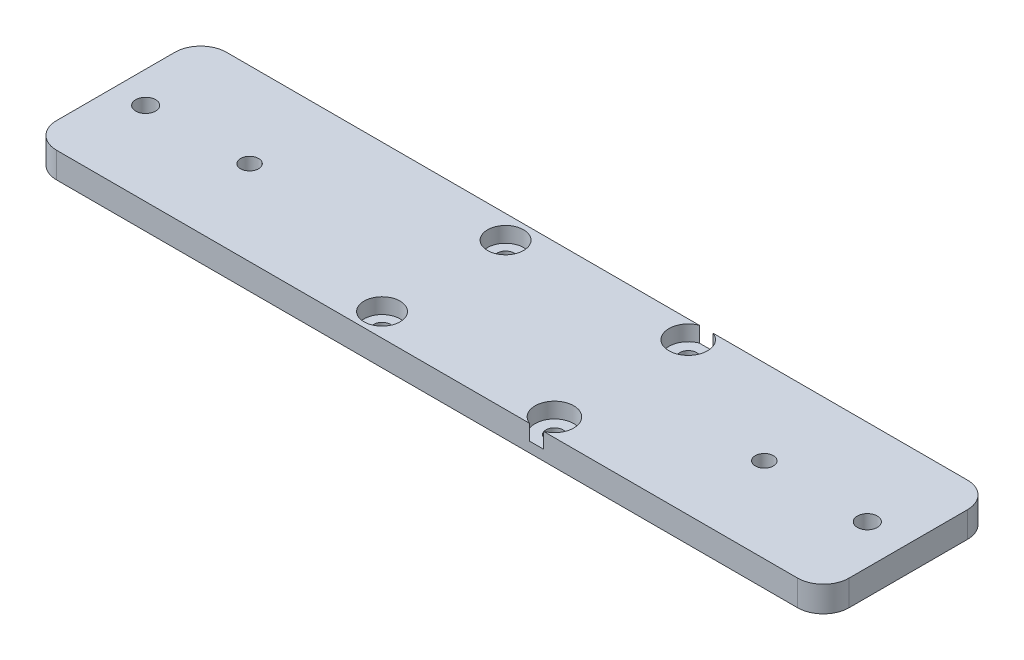
from build123d import *

# Parameters (mm, degrees)
SKETCH1_W           = 42
SKETCH1_H           = 33
BOSS_EXTRUDE1_DEPTH = 5
SKETCH2_W           = 33
SKETCH2_H           = 5
BOSS_EXTRUDE2_DEPTH = 60
SKETCH3_W           = 33
SKETCH3_H           = 5
BOSS_EXTRUDE3_DEPTH = 52
FILLET1_R           = 5
SKETCH6_R           = 1.933769561
SKETCH6_R_2         = 1.936009006
CUT_EXTRUDE1_DEPTH  = 55
SKETCH7_R           = 3.5
SKETCH7_R_2         = 1.65
SKETCH7_R_3         = 3.75
CUT_EXTRUDE6_DEPTH  = 3
SKETCH8_R           = 1.65
CUT_EXTRUDE7_DEPTH  = 9


with BuildPart() as part:
    # Sketch1 → Boss-Extrude1 (new body)
    with BuildSketch(Plane(origin=(0, 0, 0), x_dir=(1, 0, 0), z_dir=(0, 1, 0))):
        with Locations((21, 16.5)):
            Rectangle(SKETCH1_W, SKETCH1_H)
    extrude(amount=BOSS_EXTRUDE1_DEPTH)

    # Sketch2 → Boss-Extrude2 (add)
    with BuildSketch(Plane.ZY):
        with Locations((-16.5, 2.5)):
            Rectangle(SKETCH2_W, SKETCH2_H)
    extrude(amount=BOSS_EXTRUDE2_DEPTH)

    # Sketch3 → Boss-Extrude3 (add)
    with BuildSketch(Plane(origin=(42, 0, 0), x_dir=(0, 0, -1), z_dir=(1, 0, 0))):
        with Locations((16.5, 2.5)):
            Rectangle(SKETCH3_W, SKETCH3_H)
    extrude(amount=BOSS_EXTRUDE3_DEPTH)

    # Fillet1
    fillet1_edges = [part.edges().sort_by_distance(p)[0] for p in [
        (-60, 2.5, -33),
        (94, 2.5, -33),
        (94, 2.5, 0),
        (-60, 2.5, 0),
    ]]
    fillet(fillet1_edges, radius=FILLET1_R)

    # Sketch6 → Cut-Extrude1 (cut)
    with BuildSketch(Plane(origin=(0, 5, 0), x_dir=(1, 0, 0), z_dir=(0, 1, 0))):
        with Locations((-53.892928071, 16.206648626)):
            Circle(SKETCH6_R)
        with BuildLine():
            Line((-33.231112903, 14.928003086), (-32.804010339, 15.222003341))
            ThreePointArc((-32.804010339, 15.222003341), (-32.373392107, 17.150567334), (-34.01401443, 18.251998007))
            ThreePointArc((-34.01401443, 18.251998007), (-35.37580525, 17.583221312), (-35.704007275, 16.101998866))
            ThreePointArc((-35.704007275, 16.101998866), (-34.750203351, 14.919643697), (-33.231112903, 14.928003086))
        make_face()
        with BuildLine():
            ThreePointArc((64.846014701, 15.211997211), (66.795875027, 14.926365069), (67.776015126, 16.636004329))
            ThreePointArc((67.776015126, 16.636004329), (66.782491719, 18.081747119), (65.034015201, 17.940004945))
            ThreePointArc((65.034015201, 17.940004945), (64.284233669, 16.621194208), (64.846014701, 15.211997211))
        make_face()
        with Locations((86.291564463, 16.259906017)):
            Circle(SKETCH6_R_2)
    extrude(amount=-CUT_EXTRUDE1_DEPTH, mode=Mode.SUBTRACT)

    # Sketch7 → Cut-Extrude6 (cut)
    # profile 1 of 4: a face of its own
    with BuildSketch(Plane(origin=(0, 5, 0), x_dir=(1, 0, 0), z_dir=(0, 1, 0))):
        with Locations((3.750000566, 28.5)):
            Circle(SKETCH7_R)
        with Locations((3.750000566, 28.5)):
            Circle(SKETCH7_R_2, mode=Mode.SUBTRACT)
    # profile 2 of 4: a face of its own
    with BuildSketch(Plane(origin=(0, 5, 0), x_dir=(1, 0, 0), z_dir=(0, 1, 0))):
        with Locations((3.750000566, 4.500000179)):
            Circle(SKETCH7_R)
        with Locations((3.750000566, 4.500000179)):
            Circle(SKETCH7_R_2, mode=Mode.SUBTRACT)
    # profile 3 of 4: a face of its own
    with BuildSketch(Plane(origin=(0, 5, 0), x_dir=(1, 0, 0), z_dir=(0, 1, 0))):
        with Locations((38.25, 3.500000179)):
            Circle(SKETCH7_R_3)
        with Locations((38.25, 3.500000179)):
            Circle(SKETCH7_R_2, mode=Mode.SUBTRACT)
    # profile 4 of 4: a face of its own
    with BuildSketch(Plane(origin=(0, 5, 0), x_dir=(1, 0, 0), z_dir=(0, 1, 0))):
        with Locations((38.25, 29.5)):
            Circle(SKETCH7_R_3)
        with Locations((38.25, 29.5)):
            Circle(SKETCH7_R_2, mode=Mode.SUBTRACT)
    extrude(amount=-CUT_EXTRUDE6_DEPTH, mode=Mode.SUBTRACT)

    # Sketch8 → Cut-Extrude7 (cut)
    with BuildSketch(Plane(origin=(0, 5, 0), x_dir=(1, 0, 0), z_dir=(0, 1, 0))):
        with Locations((38.25, 3.500000179)):
            Circle(SKETCH8_R)
        with Locations((3.750000566, 28.5)):
            Circle(SKETCH8_R)
        with Locations((3.750000566, 4.500000179)):
            Circle(SKETCH8_R)
        with Locations((38.25, 29.5)):
            Circle(SKETCH8_R)
    extrude(amount=-CUT_EXTRUDE7_DEPTH, mode=Mode.SUBTRACT)


solid = part.part
